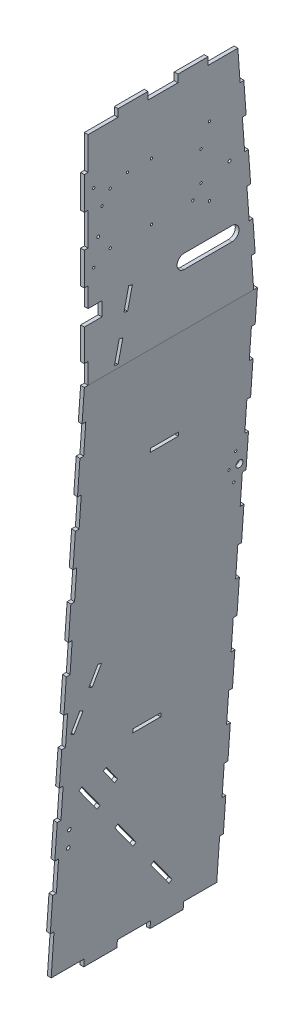
from build123d import *

# Parameters (mm, degrees)
BOSS_EXTRUDE1_DEPTH = 469.9
SKETCH2_W           = 10.16
SKETCH2_H           = 83.651125112
SKETCH2_H_2         = 83.677721465
SKETCH2_H_3         = 83.704317819
SKETCH2_H_4         = 83.730914172
SKETCH2_H_5         = 83.757510526
SKETCH2_H_6         = 83.784106879
SKETCH2_H_7         = 83.810703233
SKETCH2_H_8         = 133.264269193
CUT_EXTRUDE1_DEPTH  = 10.16
SKETCH3_W           = 10.16
SKETCH3_H           = 55.879999965
SKETCH3_H_2         = 88.9
SKETCH3_H_3         = 109.22
CUT_EXTRUDE2_DEPTH  = 12.7
SKETCH4_W           = 81.316938584
SKETCH4_H           = 20.32
SKETCH4_W_2         = 81.316938585
CUT_EXTRUDE3_DEPTH  = 12.7
SKETCH5_W           = 89.916
SKETCH5_H           = 20.32
CUT_EXTRUDE4_DEPTH  = 12.7
CUT_EXTRUDE5_DEPTH  = 137.414
SKETCH8_R           = 9.525
CUT_EXTRUDE7_DEPTH  = 2128.667464702
SKETCH13_W          = 47.788959893
SKETCH13_H          = 38.1
SKETCH13_R          = 3.175
CUT_EXTRUDE8_DEPTH  = 2128.667464702
CUT_EXTRUDE9_DEPTH  = 2128.667464702
SKETCH20_R          = 4.7625
CUT_EXTRUDE10_DEPTH = 2107.728843747
SKETCH23_R          = 3.175
CUT_EXTRUDE11_DEPTH = 2107.728843747
SKETCH24_W          = 76.2
SKETCH24_H          = 10.16
SKETCH24_R          = 4
CUT_EXTRUDE12_DEPTH = 112.014


with BuildPart() as part:
    # Sketch1 → Boss-Extrude1 (new body)
    with BuildSketch(Plane.XY):
        Polygon((-215.881789204, 2052.32), (-215.881789204, 1463.040000035), (-316.088635901, 20.32), (-317.499999939, 0), (-307.333509538, 0), (-205.715298803, 1463.040000035), (-205.715298803, 2072.64), (-215.881789204, 2072.64), align=None)
    extrude(amount=-BOSS_EXTRUDE1_DEPTH)

    # Sketch2 → Cut-Extrude1 (cut)
    with BuildSketch(Plane(origin=(-315.975651309, 21.946686571, 0), x_dir=(0, 0, 1), z_dir=(-0.9975965627192115, 0.06928995634877068, 0))):
        with Locations((-464.82, 1313.852971026)):
            Rectangle(SKETCH2_W, SKETCH2_H)
        with Locations((-464.82, 1136.066269203)):
            Rectangle(SKETCH2_W, SKETCH2_H_2)
        with Locations((-464.82, 958.27956738)):
            Rectangle(SKETCH2_W, SKETCH2_H_3)
        with Locations((-464.82, 780.492865556)):
            Rectangle(SKETCH2_W, SKETCH2_H_4)
        with Locations((-464.82, 602.706163733)):
            Rectangle(SKETCH2_W, SKETCH2_H_5)
        with Locations((-464.82, 424.91946191)):
            Rectangle(SKETCH2_W, SKETCH2_H_6)
        with Locations((-464.82, 247.132760087)):
            Rectangle(SKETCH2_W, SKETCH2_H_7)
        with Locations((-464.82, 44.63257346)):
            Rectangle(SKETCH2_W, SKETCH2_H_8)
        with Locations((-5.08, 44.63257346)):
            Rectangle(SKETCH2_W, SKETCH2_H_8)
        with Locations((-5.08, 247.132760087)):
            Rectangle(SKETCH2_W, SKETCH2_H_7)
        with Locations((-5.08, 424.91946191)):
            Rectangle(SKETCH2_W, SKETCH2_H_6)
        with Locations((-5.08, 602.706163733)):
            Rectangle(SKETCH2_W, SKETCH2_H_5)
        with Locations((-5.08, 780.492865556)):
            Rectangle(SKETCH2_W, SKETCH2_H_4)
        with Locations((-5.08, 958.27956738)):
            Rectangle(SKETCH2_W, SKETCH2_H_3)
        with Locations((-5.08, 1136.066269203)):
            Rectangle(SKETCH2_W, SKETCH2_H_2)
        with Locations((-5.08, 1313.852971026)):
            Rectangle(SKETCH2_W, SKETCH2_H)
    extrude(amount=-CUT_EXTRUDE1_DEPTH, mode=Mode.SUBTRACT)

    # Sketch3 → Cut-Extrude2 (cut)
    with BuildSketch(Plane.ZY.offset(215.881789204)):
        with Locations((-5.08, 1490.980000018)):
            Rectangle(SKETCH3_W, SKETCH3_H)
        with Locations((-5.08, 1652.27)):
            Rectangle(SKETCH3_W, SKETCH3_H_2)
        Polygon((-469.9, 1463.040000035), (-459.713026258, 1463.040000035), (-453.620872406, 1546.589538567), (-463.753970086, 1547.328410273), (-457.607940173, 1631.616820512), (-447.474842492, 1630.877948806), (-441.328812579, 1715.166359045), (-451.461910259, 1715.905230751), (-445.315880346, 1800.19364099), (-435.182782665, 1799.454769284), (-429.036752752, 1883.743179522), (-439.169850432, 1884.482051228), (-433.023820518, 1968.770461467), (-422.890722838, 1968.031589761), (-415.263026258, 2072.64), (-469.9, 2072.64), align=None)
        with Locations((-5.08, 1830.07)):
            Rectangle(SKETCH3_W, SKETCH3_H_2)
        with Locations((-5.08, 2018.03)):
            Rectangle(SKETCH3_W, SKETCH3_H_3)
    extrude(amount=-CUT_EXTRUDE2_DEPTH, mode=Mode.SUBTRACT)

    # Sketch4 → Cut-Extrude3 (cut)
    with BuildSketch(Plane.ZY.offset(215.881789204)):
        with Locations((-376.086223632, 2062.48)):
            Rectangle(SKETCH4_W, SKETCH4_H)
        with Locations((-213.452346463, 2062.48)):
            Rectangle(SKETCH4_W_2, SKETCH4_H)
        with Locations((-50.818469292, 2062.48)):
            Rectangle(SKETCH4_W_2, SKETCH4_H)
    extrude(amount=-CUT_EXTRUDE3_DEPTH, mode=Mode.SUBTRACT)

    # Sketch5 → Cut-Extrude4 (cut)
    with BuildSketch(Plane(origin=(-315.975651309, 21.946686571, 0), x_dir=(0, 0, 1), z_dir=(-0.9975965627192115, 0.06928995634877068, 0))):
        with Locations((-414.782, -11.839561137)):
            Rectangle(SKETCH5_W, SKETCH5_H)
        with Locations((-234.95, -11.839561137)):
            Rectangle(SKETCH5_W, SKETCH5_H)
        with Locations((-55.118, -11.839561137)):
            Rectangle(SKETCH5_W, SKETCH5_H)
    extrude(amount=-CUT_EXTRUDE4_DEPTH, mode=Mode.SUBTRACT)

    # Sketch6 → Cut-Extrude5 (cut)
    with BuildSketch(Plane(origin=(-315.975651309, 21.946686571, 0), x_dir=(0, 0, 1), z_dir=(-0.9975965627192115, 0.06928995634877068, 0))):
        Polygon((-225.552848619, 218.022150673), (-217.372552167, 211.996509631), (-163.440168374, 285.214095065), (-171.620464825, 291.239736107), align=None)
        Polygon((-333.417616206, 71.586979805), (-325.230382227, 65.556228551), (-271.297998434, 138.773813985), (-279.485232413, 144.804565239), align=None)
        Polygon((-117.688081031, 364.457321541), (-109.500847052, 358.426570287), (-55.568463259, 431.644155721), (-63.755697238, 437.674906975), align=None)
        Polygon((-22.52887933, 586.435803877), (-44.10850301, 632.676529752), (-53.31924736, 628.378059234), (-31.73962368, 582.137333359), align=None)
        Polygon((-96.478494721, 720.859510985), (-74.89887104, 674.61878511), (-65.68812669, 678.917255627), (-87.26775037, 725.157981502), align=None)
    extrude(amount=-CUT_EXTRUDE5_DEPTH, mode=Mode.SUBTRACT)

    # Sketch8 → Cut-Extrude7 (cut, through all)
    with BuildSketch(Plane.ZY.offset(215.881789204)):
        with Locations((-450.215, 1043.94)):
            Circle(SKETCH8_R)
    extrude(amount=CUT_EXTRUDE7_DEPTH, mode=Mode.SUBTRACT)

    # Sketch13 → Cut-Extrude8 (cut, through all)
    with BuildSketch(Plane.ZY.offset(215.881789204)):
        with BuildLine():
            Line((-400.855976046, 1605.059439633), (-270.871476046, 1605.059439633))
            ThreePointArc((-270.871476046, 1605.059439633), (-251.821476046, 1624.109439633), (-270.871476046, 1643.159439633))
            Line((-270.871476046, 1643.159439633), (-400.855976046, 1643.159439633))
            ThreePointArc((-400.855976046, 1643.159439633), (-419.905976046, 1624.109439633), (-400.855976046, 1605.059439633))
        make_face()
        with Locations((-23.894479947, 1624.109439633)):
            Rectangle(SKETCH13_W, SKETCH13_H)
        with Locations((-25.246459893, 1731.87)):
            Circle(SKETCH13_R)
        with Locations((-70.408959893, 1755.42)):
            Circle(SKETCH13_R)
        with Locations((-182.408959893, 1755.42)):
            Circle(SKETCH13_R)
        with Locations((-25.246459893, 1918.97)):
            Circle(SKETCH13_R)
        with Locations((-47.788959893, 1865.42)):
            Circle(SKETCH13_R)
        with Locations((-182.408959893, 1910.42)):
            Circle(SKETCH13_R)
        with Locations((-117.078959893, 1910.42)):
            Circle(SKETCH13_R)
        with Locations((-70.408959893, 1895.42)):
            Circle(SKETCH13_R)
        with Locations((-317.028959893, 1865.42)):
            Circle(SKETCH13_R)
        with Locations((-294.408959893, 1755.42)):
            Circle(SKETCH13_R)
        with Locations((-317.028959893, 1785.42)):
            Circle(SKETCH13_R)
        with Locations((-339.571459893, 1731.87)):
            Circle(SKETCH13_R)
        with Locations((-339.571459893, 1918.97)):
            Circle(SKETCH13_R)
    extrude(amount=-CUT_EXTRUDE8_DEPTH, mode=Mode.SUBTRACT)

    # Sketch17 → Cut-Extrude9 (cut, through all)
    with BuildSketch(Plane.ZY.offset(215.881789204)):
        Polygon((-120.524654614, 1641.945974367), (-130.424254473, 1639.660471655), (-117.483615058, 1583.608404231), (-107.584015199, 1585.893906943), align=None)
        Polygon((-94.643375784, 1529.841839519), (-104.542975642, 1527.556336807), (-91.602336227, 1471.504269383), (-81.702736369, 1473.789772095), align=None)
    extrude(amount=-CUT_EXTRUDE9_DEPTH, mode=Mode.SUBTRACT)

    # Sketch20 → Cut-Extrude10 (cut, through all)
    with BuildSketch(Plane(origin=(-315.975651309, 21.946686571, 0), x_dir=(0, 0, 1), z_dir=(-0.9975965627192116, 0.06928995634876853, 0))):
        Polygon((-128.598334701, 451.361418049), (-162.492565561, 405.347250509), (-154.823537638, 399.698212032), (-120.929306778, 445.712379572), align=None)
        with Locations((-35.56, 347.287639338)):
            Circle(SKETCH20_R)
        with Locations((-35.56, 302.837639338)):
            Circle(SKETCH20_R)
    extrude(amount=-CUT_EXTRUDE10_DEPTH, mode=Mode.SUBTRACT)

    # Sketch23 → Cut-Extrude11 (cut, through all)
    with BuildSketch(Plane(origin=(-315.975651309, 21.946686571, 0), x_dir=(0, 0, 1), z_dir=(-0.9975965627192116, 0.06928995634876853, 0))):
        with Locations((-437.515, 986.355528037)):
            Circle(SKETCH23_R)
        with Locations((-421.64, 1024.455528037)):
            Circle(SKETCH23_R)
        with Locations((-437.515, 1062.555528037)):
            Circle(SKETCH23_R)
    extrude(amount=-CUT_EXTRUDE11_DEPTH, mode=Mode.SUBTRACT)

    # Sketch24 → Cut-Extrude12 (cut)
    with BuildSketch(Plane(origin=(-205.715298803, 0, 0), x_dir=(0, 0, -1), z_dir=(1, 0, 0))):
        with Locations((234.95, 524.648419545)):
            Rectangle(SKETCH24_W, SKETCH24_H)
        with Locations((234.95, 1207.960000035)):
            Rectangle(SKETCH24_W, SKETCH24_H)
        with Locations((37.788959893, 1798.320000035)):
            Circle(SKETCH24_R)
        with Locations((394.288959893, 1798.320000035)):
            Circle(SKETCH24_R)
    extrude(amount=-CUT_EXTRUDE12_DEPTH, mode=Mode.SUBTRACT)


solid = part.part
